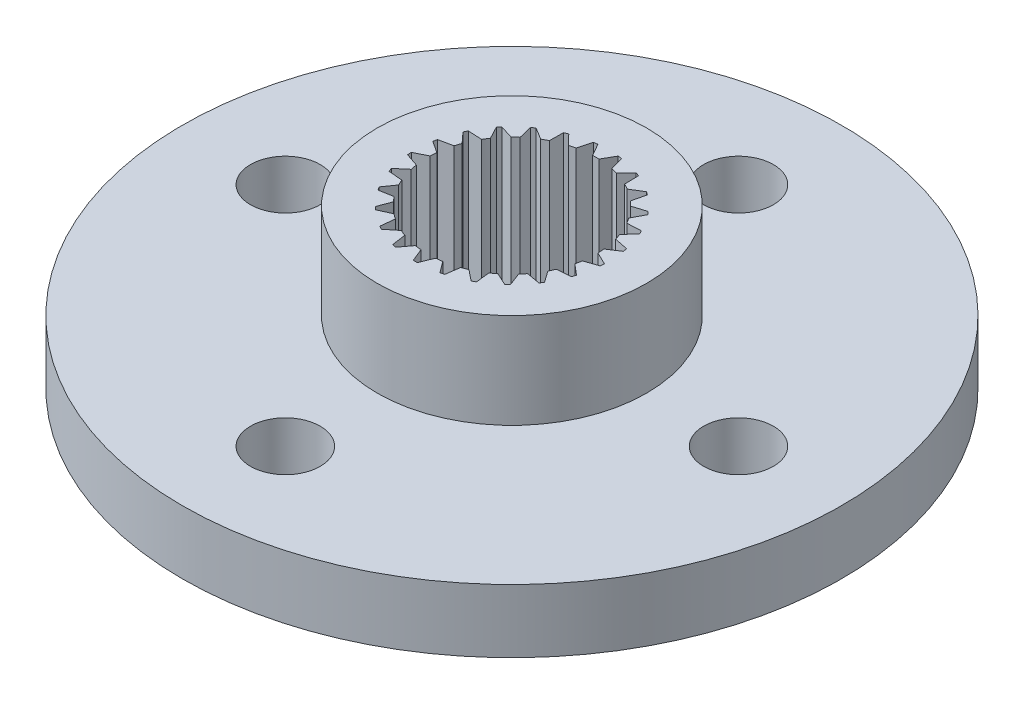
from build123d import *

# Parameters (mm, degrees)
SKETCH2_R                      = 10.4
BOSS_EXTRUDE1_DEPTH            = 2
SKETCH4_R                      = 4.25
BOSS_EXTRUDE2_DEPTH            = 3
SKETCH5_R                      = 1.5
CUT_EXTRUDE2_DEPTH             = 16.534477783
M2_CLEARANCE_HOLE1_D           = 2.2
M2_CLEARANCE_HOLE1_CSINK_D     = 2.25
M2_CLEARANCE_HOLE1_CSINK_ANGLE = 90
CUT_EXTRUDE3_DEPTH             = 10


with BuildPart() as part:
    # Sketch2 → Boss-Extrude1 (new body)
    with BuildSketch(Plane(origin=(0, 0, 0), x_dir=(1, 0, 0), z_dir=(0, 1, 0))):
        Circle(SKETCH2_R)
    extrude(amount=BOSS_EXTRUDE1_DEPTH)

    # Sketch4 → Boss-Extrude2 (add)
    with BuildSketch(Plane(origin=(0, 2, 0), x_dir=(1, 0, 0), z_dir=(0, 1, 0))):
        Circle(SKETCH4_R)
    extrude(amount=BOSS_EXTRUDE2_DEPTH)

    # Sketch5 → Cut-Extrude2 (cut, through all)
    with BuildSketch(Plane(origin=(0, 5, 0), x_dir=(1, 0, 0), z_dir=(0, 1, 0))):
        Circle(SKETCH5_R)
    extrude(amount=-CUT_EXTRUDE2_DEPTH, mode=Mode.SUBTRACT)

    # M2 Clearance Hole1 (through all)
    with Locations(Plane(origin=(0, 0, 0), x_dir=(-1, 0, 0), z_dir=(0, -1, 0))):
        with Locations((0, 7.15), (-7.15, 0), (0, -7.15), (7.15, 0)):
            CounterSinkHole(M2_CLEARANCE_HOLE1_D / 2, M2_CLEARANCE_HOLE1_CSINK_D / 2, counter_sink_angle=M2_CLEARANCE_HOLE1_CSINK_ANGLE)

    # Sketch9 → Cut-Extrude3 (cut)
    with BuildSketch(Plane(origin=(0, 5, 0), x_dir=(1, 0, 0), z_dir=(0, 1, 0))):
        with BuildLine():
            add(Edge.make_bspline(
                [(-2.289787448, 1.333931574), (-2.438528066, 1.340946003), (-2.585969344, 1.347899158), (-2.732577836, 1.354813039)],
                knots=[0, 0, 0, 0, 0.000597076, 0.000597076, 0.000597076, 0.000597076], degree=3))
            Line((-2.732577836, 1.354813039), (-2.785712054, 1.241897077))
            add(Edge.make_bspline(
                [(-2.487377393, 0.914031566), (-2.587592943, 1.024167016), (-2.686933048, 1.133340366), (-2.785712054, 1.241897077)],
                knots=[0, 0, 0, 0, 0.000597076, 0.000597076, 0.000597076, 0.000597076], degree=3))
            ThreePointArc((-2.487377393, 0.914031566), (-2.520299768, 0.818895035), (-2.549584857, 0.722576679))
            add(Edge.make_bspline(
                [(-2.549584857, 0.722576679), (-2.695396933, 0.692380449), (-2.839935251, 0.662448003), (-2.98365718, 0.632684622)],
                knots=[0, 0, 0, 0, 0.000597076, 0.000597076, 0.000597076, 0.000597076], degree=3))
            Line((-2.98365718, 0.632684622), (-3.007041032, 0.51010218))
            add(Edge.make_bspline(
                [(-2.636542265, 0.26672998), (-2.760998932, 0.348482729), (-2.884368393, 0.429521318), (-3.007041032, 0.51010218)],
                knots=[0, 0, 0, 0, 0.000597076, 0.000597076, 0.000597076, 0.000597076], degree=3))
            ThreePointArc((-2.636542266, 0.26672998), (-2.64477083, 0.166394877), (-2.649182473, 0.065819633))
            add(Edge.make_bspline(
                [(-2.649182473, 0.065819633), (-2.782904098, 0.000310085), (-2.915457582, -0.064627197), (-3.047262371, -0.129197696)],
                knots=[0, 0, 0, 0, 0.000597076, 0.000597076, 0.000597076, 0.000597076], degree=3))
            Line((-3.047262371, -0.129197696), (-3.039426562, -0.253744312))
            add(Edge.make_bspline(
                [(-2.620043491, -0.397331231), (-2.760921204, -0.349098009), (-2.900568264, -0.301286134), (-3.039426562, -0.253744312)],
                knots=[0, 0, 0, 0, 0.000597076, 0.000597076, 0.000597076, 0.000597076], degree=3))
            ThreePointArc((-2.620043491, -0.397331231), (-2.603061214, -0.496560484), (-2.582322211, -0.595073102))
            add(Edge.make_bspline(
                [(-2.582322211, -0.595073102), (-2.695551163, -0.691779763), (-2.807790991, -0.787641632), (-2.919396859, -0.882962048)],
                knots=[0, 0, 0, 0, 0.000597076, 0.000597076, 0.000597076, 0.000597076], degree=3))
            Line((-2.919396859, -0.882962048), (-2.880833743, -1.001647117))
            add(Edge.make_bspline(
                [(-2.438917747, -1.03642666), (-2.587364643, -1.024743636), (-2.734514764, -1.01316267), (-2.880833743, -1.001647117)],
                knots=[0, 0, 0, 0, 0.000597076, 0.000597076, 0.000597076, 0.000597076], degree=3))
            ThreePointArc((-2.438917747, -1.03642666), (-2.397791689, -1.128315123), (-2.353205148, -1.218575206))
            add(Edge.make_bspline(
                [(-2.353205148, -1.218575206), (-2.438826836, -1.340402544), (-2.523700565, -1.461165646), (-2.608094906, -1.581246647)],
                knots=[0, 0, 0, 0, 0.000597076, 0.000597076, 0.000597076, 0.000597076], degree=3))
            Line((-2.608094906, -1.581246647), (-2.541227545, -1.686612749))
            add(Edge.make_bspline(
                [(-2.104545832, -1.61039959), (-2.251234446, -1.636000851), (-2.396641644, -1.66137847), (-2.541227545, -1.686612749)],
                knots=[0, 0, 0, 0, 0.000597076, 0.000597076, 0.000597076, 0.000597076], degree=3))
            ThreePointArc((-2.104545832, -1.61039959), (-2.041860093, -1.689173573), (-1.976227551, -1.765509747))
            add(Edge.make_bspline(
                [(-1.976227551, -1.765509747), (-2.028862048, -1.904802904), (-2.081036751, -2.042879249), (-2.132916759, -2.180175704)],
                knots=[0, 0, 0, 0, 0.000597076, 0.000597076, 0.000597076, 0.000597076], degree=3))
            Line((-2.132916759, -2.180175704), (-2.041946674, -2.2656023))
            add(Edge.make_bspline(
                [(-1.637937563, -2.083185191), (-1.773650909, -2.144462116), (-1.908178715, -2.20520375), (-2.041946674, -2.2656023)],
                knots=[0, 0, 0, 0, 0.000597076, 0.000597076, 0.000597076, 0.000597076], degree=3))
            ThreePointArc((-1.637937563, -2.083185191), (-1.557630919, -2.143895035), (-1.475076308, -2.201510819))
            add(Edge.make_bspline(
                [(-1.475076308, -2.201510819), (-1.491416397, -2.349517492), (-1.507613745, -2.496231236), (-1.523719607, -2.642116303)],
                knots=[0, 0, 0, 0, 0.000597076, 0.000597076, 0.000597076, 0.000597076], degree=3))
            Line((-1.523719607, -2.642116303), (-1.414362784, -2.702235725))
            add(Edge.make_bspline(
                [(-1.068411652, -2.425076605), (-1.184622362, -2.51817894), (-1.2998179, -2.610467969), (-1.414362784, -2.702235725)],
                knots=[0, 0, 0, 0, 0.000597076, 0.000597076, 0.000597076, 0.000597076], degree=3))
            ThreePointArc((-1.068411652, -2.425076605), (-0.975530065, -2.463907688), (-0.881240596, -2.499182869))
            add(Edge.make_bspline(
                [(-0.881240596, -2.499182869), (-0.860259568, -2.646603255), (-0.839461823, -2.792735834), (-0.818781548, -2.938043018)],
                knots=[0, 0, 0, 0, 0.000597076, 0.000597076, 0.000597076, 0.000597076], degree=3))
            Line((-0.818781548, -2.938043018), (-0.697909279, -2.969077742))
            add(Edge.make_bspline(
                [(-0.697909279, -2.969077742), (-0.609784746, -2.851706884), (-0.521159636, -2.733669319), (-0.431753508, -2.614591538)],
                knots=[0, 0, 0, 0, 0.000597076, 0.000597076, 0.000597076, 0.000597076], degree=3))
            ThreePointArc((-0.431753508, -2.614591538), (-0.332133069, -2.629103958), (-0.232033297, -2.639822068))
            add(Edge.make_bspline(
                [(-0.232033297, -2.639822068), (-0.175049467, -2.777393202), (-0.118563426, -2.913762568), (-0.062396433, -3.049361685)],
                knots=[0, 0, 0, 0, 0.000597076, 0.000597076, 0.000597076, 0.000597076], degree=3))
            Line((-0.062396433, -3.049361685), (0.062396433, -3.049361685))
            add(Edge.make_bspline(
                [(0.062396433, -3.049361685), (0.118563426, -2.913762568), (0.175049467, -2.777393202), (0.232033297, -2.639822068)],
                knots=[0, 0, 0, 0, 0.000597076, 0.000597076, 0.000597076, 0.000597076], degree=3))
            ThreePointArc((0.232033297, -2.639822068), (0.332133069, -2.629103958), (0.431753508, -2.614591538))
            add(Edge.make_bspline(
                [(0.431753508, -2.614591538), (0.521159636, -2.733669319), (0.609784746, -2.851706884), (0.697909279, -2.969077742)],
                knots=[0, 0, 0, 0, 0.000597076, 0.000597076, 0.000597076, 0.000597076], degree=3))
            Line((0.697909279, -2.969077742), (0.818781548, -2.938043018))
            add(Edge.make_bspline(
                [(0.818781548, -2.938043018), (0.839461823, -2.792735834), (0.860259568, -2.646603255), (0.881240596, -2.499182869)],
                knots=[0, 0, 0, 0, 0.000597076, 0.000597076, 0.000597076, 0.000597076], degree=3))
            ThreePointArc((0.881240596, -2.499182869), (0.975530065, -2.463907688), (1.068411652, -2.425076605))
            add(Edge.make_bspline(
                [(1.068411652, -2.425076605), (1.184622362, -2.51817894), (1.2998179, -2.610467969), (1.414362784, -2.702235725)],
                knots=[0, 0, 0, 0, 0.000597076, 0.000597076, 0.000597076, 0.000597076], degree=3))
            Line((1.414362784, -2.702235725), (1.523719607, -2.642116303))
            add(Edge.make_bspline(
                [(1.523719607, -2.642116303), (1.507613745, -2.496231236), (1.491416397, -2.349517492), (1.475076308, -2.201510819)],
                knots=[0, 0, 0, 0, 0.000597076, 0.000597076, 0.000597076, 0.000597076], degree=3))
            ThreePointArc((1.475076308, -2.201510819), (1.557630919, -2.143895035), (1.637937563, -2.083185191))
            add(Edge.make_bspline(
                [(1.637937563, -2.083185191), (1.773650908, -2.144462116), (1.908178715, -2.20520375), (2.041946674, -2.2656023)],
                knots=[0, 0, 0, 0, 0.000597076, 0.000597076, 0.000597076, 0.000597076], degree=3))
            Line((2.041946674, -2.2656023), (2.132916759, -2.180175704))
            add(Edge.make_bspline(
                [(2.132916759, -2.180175704), (2.081036751, -2.042879249), (2.028862048, -1.904802904), (1.976227551, -1.765509747)],
                knots=[0, 0, 0, 0, 0.000597076, 0.000597076, 0.000597076, 0.000597076], degree=3))
            ThreePointArc((1.976227551, -1.765509747), (2.041860093, -1.689173573), (2.104545832, -1.61039959))
            add(Edge.make_bspline(
                [(2.104545832, -1.61039959), (2.251234445, -1.636000851), (2.396641644, -1.66137847), (2.541227545, -1.686612749)],
                knots=[0, 0, 0, 0, 0.000597076, 0.000597076, 0.000597076, 0.000597076], degree=3))
            Line((2.541227545, -1.686612749), (2.608094906, -1.581246647))
            add(Edge.make_bspline(
                [(2.608094906, -1.581246647), (2.523700565, -1.461165646), (2.438826836, -1.340402544), (2.353205148, -1.218575206)],
                knots=[0, 0, 0, 0, 0.000597076, 0.000597076, 0.000597076, 0.000597076], degree=3))
            ThreePointArc((2.353205148, -1.218575206), (2.397791689, -1.128315123), (2.438917747, -1.03642666))
            add(Edge.make_bspline(
                [(2.438917747, -1.03642666), (2.587364643, -1.024743636), (2.734514763, -1.01316267), (2.880833743, -1.001647117)],
                knots=[0, 0, 0, 0, 0.000597076, 0.000597076, 0.000597076, 0.000597076], degree=3))
            Line((2.880833743, -1.001647117), (2.919396859, -0.882962048))
            add(Edge.make_bspline(
                [(2.919396859, -0.882962048), (2.807790991, -0.787641632), (2.695551163, -0.691779763), (2.582322211, -0.595073102)],
                knots=[0, 0, 0, 0, 0.000597076, 0.000597076, 0.000597076, 0.000597076], degree=3))
            ThreePointArc((2.582322211, -0.595073102), (2.603061214, -0.496560484), (2.620043491, -0.397331231))
            add(Edge.make_bspline(
                [(2.620043491, -0.397331231), (2.760921204, -0.349098009), (2.900568264, -0.301286134), (3.039426562, -0.253744312)],
                knots=[0, 0, 0, 0, 0.000597076, 0.000597076, 0.000597076, 0.000597076], degree=3))
            Line((3.039426562, -0.253744312), (3.047262371, -0.129197696))
            add(Edge.make_bspline(
                [(3.047262371, -0.129197696), (2.915457582, -0.064627197), (2.782904098, 0.000310085), (2.649182473, 0.065819633)],
                knots=[0, 0, 0, 0, 0.000597076, 0.000597076, 0.000597076, 0.000597076], degree=3))
            ThreePointArc((2.649182473, 0.065819633), (2.64477083, 0.166394877), (2.636542266, 0.26672998))
            add(Edge.make_bspline(
                [(2.636542266, 0.26672998), (2.760998932, 0.348482729), (2.884368393, 0.429521318), (3.007041032, 0.51010218)],
                knots=[0, 0, 0, 0, 0.000597076, 0.000597076, 0.000597076, 0.000597076], degree=3))
            Line((3.007041032, 0.51010218), (2.98365718, 0.632684622))
            add(Edge.make_bspline(
                [(2.98365718, 0.632684622), (2.839935251, 0.662448003), (2.695396933, 0.692380449), (2.549584857, 0.722576679)],
                knots=[0, 0, 0, 0, 0.000597076, 0.000597076, 0.000597076, 0.000597076], degree=3))
            ThreePointArc((2.549584857, 0.722576679), (2.520299768, 0.818895035), (2.487377393, 0.914031566))
            add(Edge.make_bspline(
                [(2.487377393, 0.914031566), (2.587592943, 1.024167016), (2.686933048, 1.133340366), (2.785712054, 1.241897077)],
                knots=[0, 0, 0, 0, 0.000597076, 0.000597076, 0.000597076, 0.000597076], degree=3))
            Line((2.785712054, 1.241897077), (2.732577836, 1.354813039))
            add(Edge.make_bspline(
                [(2.732577836, 1.354813039), (2.585969344, 1.347899158), (2.438528066, 1.340946003), (2.289787448, 1.333931574)],
                knots=[0, 0, 0, 0, 0.000597076, 0.000597076, 0.000597076, 0.000597076], degree=3))
            ThreePointArc((2.289787448, 1.333931574), (2.237469003, 1.419941007), (2.181921452, 1.503901187))
            add(Edge.make_bspline(
                [(2.181921452, 1.503901187), (2.251598972, 1.635499123), (2.320667817, 1.765947471), (2.389346544, 1.895659013)],
                knots=[0, 0, 0, 0, 0.000597076, 0.000597076, 0.000597076, 0.000597076], degree=3))
            Line((2.389346544, 1.895659013), (2.309800577, 1.991813569))
            add(Edge.make_bspline(
                [(2.309800577, 1.991813569), (2.169517473, 1.948656851), (2.028437513, 1.905254989), (1.886114272, 1.861470643)],
                knots=[0, 0, 0, 0, 0.000597076, 0.000597076, 0.000597076, 0.000597076], degree=3))
            ThreePointArc((1.886114272, 1.861470643), (1.814049831, 1.931766863), (1.739367361, 1.999275165))
            add(Edge.make_bspline(
                [(1.739367361, 1.999275165), (1.774128758, 2.144066805), (1.808586493, 2.287593601), (1.842849602, 2.430309722)],
                knots=[0, 0, 0, 0, 0.000597076, 0.000597076, 0.000597076, 0.000597076], degree=3))
            Line((1.842849602, 2.430309722), (1.741890052, 2.503661128))
            add(Edge.make_bspline(
                [(1.741890052, 2.503661128), (1.616746839, 2.426973269), (1.49089277, 2.349849796), (1.3639296, 2.272046665)],
                knots=[0, 0, 0, 0, 0.000597076, 0.000597076, 0.000597076, 0.000597076], degree=3))
            ThreePointArc((1.3639296, 2.272046665), (1.276647236, 2.322212702), (1.187522421, 2.369027332))
            add(Edge.make_bspline(
                [(1.187522421, 2.369027332), (1.185183509, 2.517914884), (1.182865028, 2.665501813), (1.180559643, 2.812255132)],
                knots=[0, 0, 0, 0, 0.000597076, 0.000597076, 0.000597076, 0.000597076], degree=3))
            Line((1.180559643, 2.812255132), (1.06453017, 2.858194451))
            add(Edge.make_bspline(
                [(0.756044214, 2.539861639), (0.859669752, 2.646794898), (0.962390056, 2.752794029), (1.06453017, 2.858194451)],
                knots=[0, 0, 0, 0, 0.000597076, 0.000597076, 0.000597076, 0.000597076], degree=3))
            ThreePointArc((0.756044214, 2.539861639), (0.659028201, 2.566745377), (0.561061081, 2.589924799))
            add(Edge.make_bspline(
                [(0.561061081, 2.589924799), (0.521768821, 2.733553111), (0.482819803, 2.875926742), (0.444090779, 3.01749621)],
                knots=[0, 0, 0, 0, 0.000597076, 0.000597076, 0.000597076, 0.000597076], degree=3))
            Line((0.444090779, 3.01749621), (0.320281942, 3.033136904))
            add(Edge.make_bspline(
                [(0.100653791, 2.648087766), (0.174430521, 2.777432143), (0.247562766, 2.905646617), (0.320281942, 3.033136904)],
                knots=[0, 0, 0, 0, 0.000597076, 0.000597076, 0.000597076, 0.000597076], degree=3))
            ThreePointArc((0.100653791, 2.648087766), (0, 2.65), (-0.100653791, 2.648087766))
            add(Edge.make_bspline(
                [(-0.100653791, 2.648087766), (-0.174430521, 2.777432143), (-0.247562766, 2.905646617), (-0.320281942, 3.033136904)],
                knots=[0, 0, 0, 0, 0.000597076, 0.000597076, 0.000597076, 0.000597076], degree=3))
            Line((-0.320281942, 3.033136904), (-0.444090779, 3.017496211))
            add(Edge.make_bspline(
                [(-0.561061081, 2.589924799), (-0.521768821, 2.733553111), (-0.482819803, 2.875926742), (-0.444090779, 3.017496211)],
                knots=[0, 0, 0, 0, 0.000597076, 0.000597076, 0.000597076, 0.000597076], degree=3))
            ThreePointArc((-0.561061081, 2.589924799), (-0.659028201, 2.566745377), (-0.756044214, 2.539861639))
            add(Edge.make_bspline(
                [(-0.756044214, 2.539861639), (-0.859669752, 2.646794898), (-0.962390056, 2.752794029), (-1.06453017, 2.858194451)],
                knots=[0, 0, 0, 0, 0.000597076, 0.000597076, 0.000597076, 0.000597076], degree=3))
            Line((-1.06453017, 2.858194451), (-1.180559643, 2.812255133))
            add(Edge.make_bspline(
                [(-1.187522421, 2.369027332), (-1.185183509, 2.517914884), (-1.182865028, 2.665501813), (-1.180559643, 2.812255133)],
                knots=[0, 0, 0, 0, 0.000597076, 0.000597076, 0.000597076, 0.000597076], degree=3))
            ThreePointArc((-1.187522421, 2.369027332), (-1.276647236, 2.322212702), (-1.3639296, 2.272046665))
            add(Edge.make_bspline(
                [(-1.3639296, 2.272046665), (-1.49089277, 2.349849796), (-1.616746839, 2.426973269), (-1.741890052, 2.503661128)],
                knots=[0, 0, 0, 0, 0.000597076, 0.000597076, 0.000597076, 0.000597076], degree=3))
            Line((-1.741890052, 2.503661128), (-1.842849602, 2.430309722))
            add(Edge.make_bspline(
                [(-1.739367361, 1.999275165), (-1.774128758, 2.144066805), (-1.808586493, 2.287593602), (-1.842849602, 2.430309722)],
                knots=[0, 0, 0, 0, 0.000597076, 0.000597076, 0.000597076, 0.000597076], degree=3))
            ThreePointArc((-1.739367361, 1.999275165), (-1.814049831, 1.931766863), (-1.886114272, 1.861470643))
            add(Edge.make_bspline(
                [(-1.886114272, 1.861470643), (-2.028437513, 1.905254989), (-2.169517473, 1.948656851), (-2.309800577, 1.991813569)],
                knots=[0, 0, 0, 0, 0.000597076, 0.000597076, 0.000597076, 0.000597076], degree=3))
            Line((-2.309800577, 1.991813569), (-2.389346544, 1.895659013))
            add(Edge.make_bspline(
                [(-2.181921452, 1.503901187), (-2.251598972, 1.635499123), (-2.320667817, 1.765947471), (-2.389346544, 1.895659013)],
                knots=[0, 0, 0, 0, 0.000597076, 0.000597076, 0.000597076, 0.000597076], degree=3))
            ThreePointArc((-2.181921452, 1.503901187), (-2.237469003, 1.419941007), (-2.289787448, 1.333931574))
        make_face()
    extrude(amount=-CUT_EXTRUDE3_DEPTH, mode=Mode.SUBTRACT)


solid = part.part
